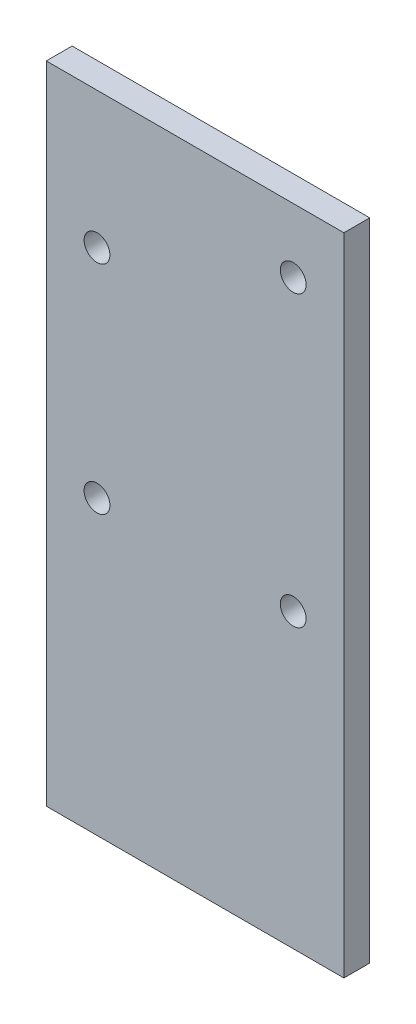
from build123d import *

# Parameters (mm, degrees)
SKETCH_1_W          = 57.64
SKETCH_1_H          = 125
EXTRUDE_1_DEPTH     = 5
SKETCH_2_R          = 2.5
CUT_EXTRUDE_1_DEPTH = 5


with BuildPart() as part:
    # 스케치1 → 보스-돌출1 (new body)
    with BuildSketch(Plane.XY):
        Rectangle(SKETCH_1_W, SKETCH_1_H)
    extrude(amount=EXTRUDE_1_DEPTH)

    # 스케치2 → 컷-돌출1 (cut)
    with BuildSketch(Plane.XY.offset(5)):
        with Locations((-19, 36.1)):
            Circle(SKETCH_2_R)
        with Locations((19, 50.1)):
            Circle(SKETCH_2_R)
        with Locations((-19, -5.9)):
            Circle(SKETCH_2_R)
        with Locations((19, -5.9)):
            Circle(SKETCH_2_R)
    extrude(amount=-CUT_EXTRUDE_1_DEPTH, mode=Mode.SUBTRACT)


solid = part.part
